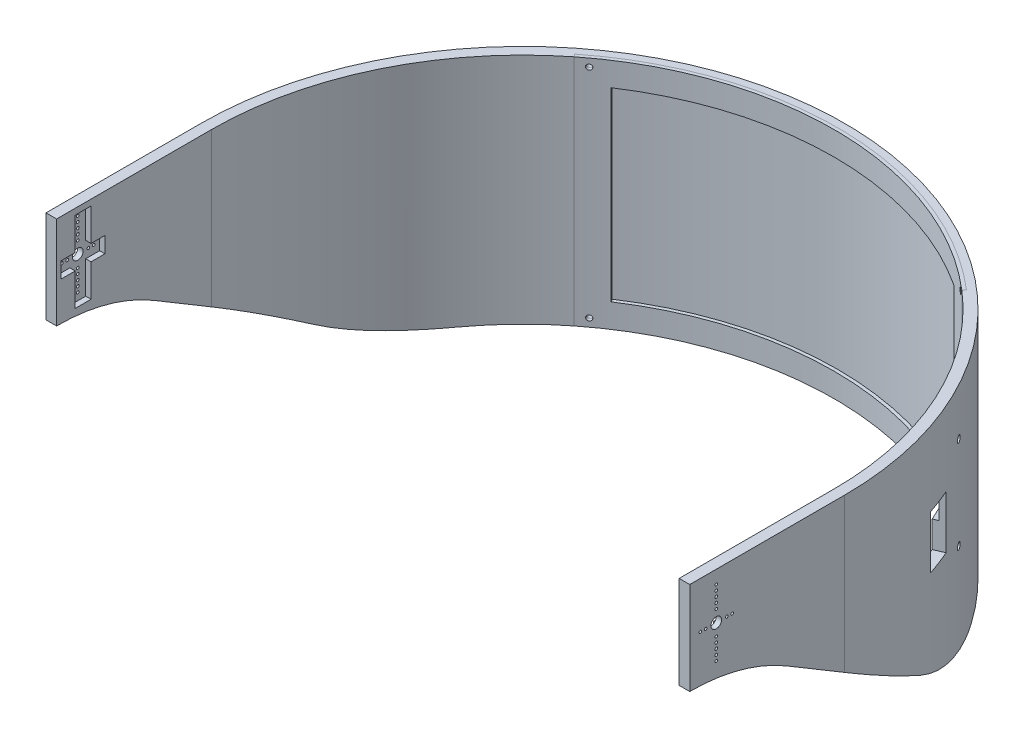
from build123d import *

# Parameters (mm, degrees)
BOSS_EXTRUDE1_DEPTH      = 44
SKETCH2_R                = 2
SKETCH2_R_2              = 0.5
CUT_EXTRUDE1_DEPTH       = 300.808272067
CUT_EXTRUDE2_START       = -2
CUT_EXTRUDE2_DEPTH       = 239
CUT_EXTRUDE3_DEPTH       = 38
CUT_EXTRUDE4_DEPTH       = 28
CUT_EXTRUDE5_DEPTH       = 10
CUT_EXTRUDE6_DEPTH       = 20
CUT_EXTRUDE7_DEPTH       = 214.537467438
CUT_EXTRUDE7_DEPTH_BACK  = 214.537467438
CUT_EXTRUDE8_DEPTH       = 259.793095901
CUT_EXTRUDE8_DEPTH_BACK  = 259.793095901
SKETCH9_R                = 1
CUT_EXTRUDE9_DEPTH       = 260.959679351
CUT_EXTRUDE9_DEPTH_BACK  = 260.959679351
SKETCH10_R               = 1
BOSS_EXTRUDE2_DEPTH      = 44
BOSS_EXTRUDE2_DEPTH_BACK = 44
SKETCH12_R               = 1
CUT_EXTRUDE10_DEPTH      = 259.793096001
SKETCH13_R               = 1
CUT_EXTRUDE12_DEPTH      = 260.959679351
CUT_EXTRUDE13_DEPTH      = 35
CUT_EXTRUDE14_DEPTH      = 264.215137533
CUT_EXTRUDE14_DEPTH_BACK = 264.215137533
SKETCH16_R               = 1.25
BOSS_EXTRUDE3_DEPTH      = 38
BOSS_EXTRUDE3_DEPTH_BACK = 27
SKETCH18_R               = 1.5
CUT_EXTRUDE15_DEPTH      = 251.304617192
CUT_EXTRUDE16_DEPTH      = 300.80827222
CHAMFER2_SIZE            = 50.217391304
CHAMFER2_SIZE_2          = 30
CHAMFER3_SIZE            = 30
CHAMFER3_SIZE_2          = 50.217391304
FILLET1_R                = 71


with BuildPart() as part:
    # Sketch1 → Boss-Extrude1 (new, symmetric)
    with BuildSketch(Plane(origin=(0, 0, 0), x_dir=(1, 0, 0), z_dir=(0, 1, 0))):
        with BuildLine():
            Line((-117.5, -10), (-117.5, 10))
            Line((-117.5, 10), (-117.5, 48.5))
            ThreePointArc((-117.5, 48.5), (0, 166), (117.5, 48.5))
            Line((117.5, 48.5), (117.5, 10))
            Line((117.5, 10), (117.5, -10))
            Line((117.5, -10), (121.5, -10))
            Line((121.5, -10), (121.5, 48.5))
            ThreePointArc((121.5, 48.5), (0, 170), (-121.5, 48.5))
            Line((-121.5, 48.5), (-121.5, -10))
            Line((-121.5, -10), (-117.5, -10))
        make_face()
    extrude(amount=BOSS_EXTRUDE1_DEPTH, both=True)

    # Sketch2 → Cut-Extrude1 (cut, through all)
    with BuildSketch(Plane.ZY.offset(121.5)):
        with Locations((0, 26.5)):
            Circle(SKETCH2_R)
        with Locations((4, 26.5)):
            Circle(SKETCH2_R_2)
        with Locations((6, 26.5)):
            Circle(SKETCH2_R_2)
        with Locations((-6, 26.5)):
            Circle(SKETCH2_R_2)
        with Locations((-4, 26.5)):
            Circle(SKETCH2_R_2)
        with Locations((0, 31)):
            Circle(SKETCH2_R_2)
        with Locations((0, 33)):
            Circle(SKETCH2_R_2)
        with Locations((0, 35)):
            Circle(SKETCH2_R_2)
        with Locations((0, 37)):
            Circle(SKETCH2_R_2)
        with Locations((0, 39)):
            Circle(SKETCH2_R_2)
        with Locations((0, 14)):
            Circle(SKETCH2_R_2)
        with Locations((0, 16)):
            Circle(SKETCH2_R_2)
        with Locations((0, 18)):
            Circle(SKETCH2_R_2)
        with Locations((0, 20)):
            Circle(SKETCH2_R_2)
        with Locations((0, 22)):
            Circle(SKETCH2_R_2)
    extrude(amount=-CUT_EXTRUDE1_DEPTH, mode=Mode.SUBTRACT)

    # Sketch3 → Cut-Extrude2 (cut)
    with BuildSketch(Plane(origin=(-117.5, 0, 0), x_dir=(0, 0, -1), z_dir=(1, 0, 0)).offset(CUT_EXTRUDE2_START)):
        Polygon((-8.25, 29.5), (-8.25, 23.5), (-3, 23.5), (-3, 11.25), (3, 11.25), (3, 23.5), (8.25, 23.5), (8.25, 29.5), (3, 29.5), (3, 41.75), (-3, 41.75), (-3, 29.5), align=None)
    extrude(amount=CUT_EXTRUDE2_DEPTH, mode=Mode.SUBTRACT)

    # Sketch4 → Cut-Extrude3 (cut, symmetric)
    with BuildSketch(Plane(origin=(0, 0, 0), x_dir=(1, 0, 0), z_dir=(0, 1, 0))):
        with BuildLine():
            Line((71.640522456, 144.144579262), (70.441517896, 142.543833166))
            ThreePointArc((70.441517896, 142.543833166), (67.607926189, 144.601083847), (64.714290943, 146.572985821))
            ThreePointArc((64.714290943, 146.572985821), (0, 166), (-64.714290943, 146.572985821))
            ThreePointArc((-64.714290943, 146.572985821), (-65.547021891, 146.01839786), (-66.375000417, 145.456739424))
            Line((-66.375000417, 145.456739424), (-67.504787658, 147.107066903))
            ThreePointArc((-67.504787658, 147.107066903), (-66.662715881, 147.678285483), (-65.815810789, 148.242313239))
            ThreePointArc((-65.815810789, 148.242313239), (0, 168), (65.815810789, 148.242313239))
            ThreePointArc((65.815810789, 148.242313239), (68.7586994, 146.236846976), (71.640522456, 144.144579262))
        make_face()
    extrude(amount=CUT_EXTRUDE3_DEPTH, both=True, mode=Mode.SUBTRACT)

    # Sketch5 → Cut-Extrude4 (cut, symmetric)
    with BuildSketch(Plane(origin=(0, 0, 0), x_dir=(1, 0, 0), z_dir=(0, 1, 0))):
        with BuildLine():
            Line((70.441517896, 142.543833166), (71.640522456, 144.144579262))
            ThreePointArc((71.640522456, 144.144579262), (84.328204672, 133.169970455), (95.354040219, 120.526779838))
            Line((95.354040219, 120.526779838), (93.758156701, 119.321310719))
            ThreePointArc((93.758156701, 119.321310719), (82.916853966, 131.752899819), (70.441517896, 142.543833166))
        make_face()
    extrude(amount=CUT_EXTRUDE4_DEPTH, both=True, mode=Mode.SUBTRACT)

    # Sketch6 → Cut-Extrude5 (cut)
    with BuildSketch(Plane(origin=(0, 16, 0), x_dir=(-1, 0, 0), z_dir=(0, -1, 0))):
        with BuildLine():
            Line((-93.758156701, 119.321310719), (-95.354040219, 120.526779838))
            ThreePointArc((-95.354040219, 120.526779838), (-103.243255193, 108.675412396), (-109.667029947, 95.969911971))
            Line((-109.667029947, 95.969911971), (-107.831598484, 95.175436457))
            ThreePointArc((-107.831598484, 95.175436457), (-101.515334604, 107.668292524), (-93.758156701, 119.321310719))
        make_face()
    extrude(amount=CUT_EXTRUDE5_DEPTH, mode=Mode.SUBTRACT)

    # Sketch7 → Cut-Extrude6 (cut)
    with BuildSketch(Plane(origin=(0, 16, 0), x_dir=(-1, 0, 0), z_dir=(0, -1, 0))):
        with BuildLine():
            Line((-107.831598484, 95.175436457), (-111.502461411, 96.764387486))
            ThreePointArc((-111.502461411, 96.764387486), (-113.455646079, 91.974893591), (-115.203210804, 87.106608508))
            Line((-115.203210804, 87.106608508), (-111.410512506, 85.835609051))
            ThreePointArc((-111.410512506, 85.835609051), (-109.720480776, 90.543621374), (-107.831598484, 95.175436457))
        make_face()
    extrude(amount=CUT_EXTRUDE6_DEPTH, mode=Mode.SUBTRACT)

    # Sketch8 → Cut-Extrude7 (cut, two sides: drawn at the far end of the back side and taken through both)
    with BuildSketch(Plane(origin=(0, 0, 0), x_dir=(1, 0, 0), z_dir=(0, 1, 0)).offset(-CUT_EXTRUDE7_DEPTH_BACK)):
        with BuildLine():
            Line((-72.820611953, 140.71392777), (-73.595299314, 141.694927002))
            ThreePointArc((-73.595299314, 141.694927002), (2.527686356, 167.223095064), (77.495164046, 138.478119838))
            Line((77.495164046, 138.478119838), (76.679425477, 137.530981734))
            ThreePointArc((76.679425477, 137.530981734), (2.501079131, 165.973378274), (-72.820611953, 140.71392777))
        make_face()
    extrude(amount=CUT_EXTRUDE7_DEPTH + CUT_EXTRUDE7_DEPTH_BACK, mode=Mode.SUBTRACT)

    # Sketch9 → Cut-Extrude8 (cut, two sides: drawn at the far end of the back side and taken through both)
    with BuildSketch(Plane(origin=(-93.531066858, 0, -127.111293379), x_dir=(0.8054487063461717, 0, -0.5926654886572009), z_dir=(0.5926654886572009, 0, 0.8054487063461717)).offset(-CUT_EXTRUDE8_DEPTH_BACK)):
        with Locations((28.765559472, 41)):
            Circle(SKETCH9_R)
        with Locations((28.778329435, -41)):
            Circle(SKETCH9_R)
    extrude(amount=CUT_EXTRUDE8_DEPTH + CUT_EXTRUDE8_DEPTH_BACK, mode=Mode.SUBTRACT)

    # Sketch10 → Cut-Extrude9 (cut, two sides: drawn at the far end of the back side and taken through both)
    with BuildSketch(Plane(origin=(98.067880737, 0, -122.034012983), x_dir=(0.7794938560659227, 0, 0.6264098724920278), z_dir=(-0.6264098724920278, 0, 0.7794938560659227)).offset(-CUT_EXTRUDE9_DEPTH_BACK)):
        with Locations((-30.380878816, 41)):
            Circle(SKETCH10_R)
        with Locations((-30.380878816, -41)):
            Circle(SKETCH10_R)
    extrude(amount=CUT_EXTRUDE9_DEPTH + CUT_EXTRUDE9_DEPTH_BACK, mode=Mode.SUBTRACT)

    # Sketch16 → Cut-Extrude14 (cut, two sides: drawn at the far end of the back side and taken through both)
    with BuildSketch(Plane(origin=(106.9937578, 16, -106.072439516), x_dir=(-0.4738472388146497, 0, -0.8806070600828343), z_dir=(0.8806070600828343, 0, -0.4738472388146497)).offset(-CUT_EXTRUDE14_DEPTH_BACK)):
        with Locations((0, -24.75)):
            Circle(SKETCH16_R)
        with Locations((0, 10.25)):
            Circle(SKETCH16_R)
    extrude(amount=CUT_EXTRUDE14_DEPTH + CUT_EXTRUDE14_DEPTH_BACK, mode=Mode.SUBTRACT)

    # Sketch17 → Boss-Extrude3 (add, two sides: drawn at the far end of the back side and taken through both)
    with BuildSketch(Plane(origin=(0, 0, 0), x_dir=(1, 0, 0), z_dir=(0, 1, 0)).offset(-BOSS_EXTRUDE3_DEPTH_BACK)):
        with BuildLine():
            Line((-45.124137252, 161.309849912), (-75.299611509, 149.239607437))
            Line((-75.299611509, 149.239607437), (-75.299611509, 143.853125311))
            ThreePointArc((-75.299611509, 143.853125311), (-60.841220606, 153.66936757), (-45.124137252, 161.309849912))
        make_face()
    extrude(amount=BOSS_EXTRUDE3_DEPTH + BOSS_EXTRUDE3_DEPTH_BACK)

    # Sketch18 → Cut-Extrude15 (cut, through all)
    with BuildSketch(Plane(origin=(-61.848328132, 0, -154.620144312), x_dir=(-0.9284761309654559, 0, 0.3713920761505526), z_dir=(-0.3713920761505526, 0, -0.9284761309654559))):
        with Locations((10.987484307, 34.5)):
            Circle(SKETCH18_R)
        with Locations((10.987484307, -23.5)):
            Circle(SKETCH18_R)
    extrude(amount=-CUT_EXTRUDE15_DEPTH, mode=Mode.SUBTRACT)

    # Sketch19 → Cut-Extrude16 (cut, through all)
    with BuildSketch(Plane.ZY.offset(121.5)):
        Polygon((10, 9), (-10, 9), (-48.5, -14), (-48.5, -44), (10, -44), align=None)
    extrude(amount=-CUT_EXTRUDE16_DEPTH, mode=Mode.SUBTRACT)

    # Chamfer2
    # the kernel refuses this chamfer: 50.217391304, 30 mm, written as the material it takes off along each edge
    with BuildSketch(Plane(origin=(-251.380053142, -44, -48.5), x_dir=(0, -0.019829259578794618, -0.9998033809027438), z_dir=(1, 0, 0))) as chamfer2_piece_1:
        Polygon((CHAMFER2_SIZE * 0.99980338091, CHAMFER2_SIZE * 0.0198292595789), (-CHAMFER2_SIZE_2 * 0.0198292595788, CHAMFER2_SIZE_2 * 0.999803380903), (0, 0), align=None)
    extrude(amount=263.760106283, mode=Mode.SUBTRACT)

    # Chamfer3
    # the kernel refuses this chamfer: 50.217391304, 30 mm, written as the material it takes off along each edge
    with BuildSketch(Plane(origin=(-12.380053142, -44, -48.5), x_dir=(0, 0.998459431976932, 0.05548659924974885), z_dir=(1, 0, 0))) as chamfer3_piece_1:
        Polygon((CHAMFER3_SIZE * 0.998459431977, -CHAMFER3_SIZE * 0.0554865992497), (-CHAMFER3_SIZE_2 * 0.0554865992501, -CHAMFER3_SIZE_2 * 0.998459431984), (0, 0), align=None)
    extrude(amount=263.760106283, mode=Mode.SUBTRACT)

    # Fillet1
    # the kernel refuses this fillet: 71 mm, written as the material it adds along each edge
    with BuildSketch(Plane(origin=(117.5, 9, -10), x_dir=(0, -0.5128552521265802, -0.8584750959498954), z_dir=(1, 0, 0))) as fillet1_piece_1:
        with BuildLine():
            CenterArc((FILLET1_R * 0.27595486926, -FILLET1_R), FILLET1_R, 90, 30.854204506)
            Line((-FILLET1_R * 0.236900382866, -FILLET1_R * 0.14152490405), (0, 0))
            Line((0, 0), (FILLET1_R * 0.27595486926, 0))
        make_face()
    extrude(amount=4)
    with BuildSketch(Plane(origin=(-121.5, 9, -10), x_dir=(0, -0.5128552521254461, -0.8584750959505728), z_dir=(1, 0, 0))) as fillet1_piece_2:
        with BuildLine():
            CenterArc((FILLET1_R * 0.27595486926, -FILLET1_R), FILLET1_R, 90, 30.854204506)
            Line((-FILLET1_R * 0.236900382866, -FILLET1_R * 0.141524904049), (0, 0))
            Line((0, 0), (FILLET1_R * 0.275954869261, 0))
        make_face()
    extrude(amount=4)
    # the kernel refuses this fillet: 71 mm, written as the material it takes off along each edge
    with BuildSketch(Plane(origin=(57.246366669, -44, -98.717391304), x_dir=(0, 0.5128552521258057, 0.858475095950358), z_dir=(1, 0, 0))) as fillet1_2_piece_1:
        with BuildLine():
            CenterArc((FILLET1_R * 0.27595486926, -FILLET1_R), FILLET1_R, 90, 30.854204506)
            Line((-FILLET1_R * 0.236900382866, -FILLET1_R * 0.14152490405), (0, 0))
            Line((0, 0), (FILLET1_R * 0.27595486926, 0))
        make_face()
    extrude(amount=102.372251327, mode=Mode.SUBTRACT)
    with BuildSketch(Plane(origin=(-159.618617996, -44, -98.717391304), x_dir=(0, 0, -1), z_dir=(1, 0, 0))) as fillet1_2_piece_2:
        with BuildLine():
            CenterArc((FILLET1_R * 0.27595486926, FILLET1_R), FILLET1_R, 239.145795494, 30.854204506)
            Line((-FILLET1_R * 0.236900382866, FILLET1_R * 0.14152490405), (0, 0))
            Line((0, 0), (FILLET1_R * 0.27595486926, 0))
        make_face()
    extrude(amount=102.372251327, mode=Mode.SUBTRACT)


with BuildPart() as body_2:
    # Sketch11 → Boss-Extrude2 (new, two sides: drawn at the far end of the back side and taken through both)
    with BuildSketch(Plane(origin=(0, 0, 0), x_dir=(1, 0, 0), z_dir=(0, 1, 0)).offset(-BOSS_EXTRUDE2_DEPTH_BACK)):
        with BuildLine():
            Line((-73.595299314, 141.694927002), (-72.820611953, 140.71392777))
            ThreePointArc((-72.820611953, 140.71392777), (2.501079131, 165.973378274), (76.679425477, 137.530981734))
            Line((76.679425477, 137.530981734), (77.495164046, 138.478119838))
            ThreePointArc((77.495164046, 138.478119838), (2.527686356, 167.223095064), (-73.595299314, 141.694927002))
        make_face()
    extrude(amount=BOSS_EXTRUDE2_DEPTH + BOSS_EXTRUDE2_DEPTH_BACK)

    # Sketch12 → Cut-Extrude10 (cut, through all)
    with BuildSketch(Plane(origin=(-93.531066858, 0, -127.111293379), x_dir=(0.8054487063461717, 0, -0.5926654886572009), z_dir=(0.5926654886572009, 0, 0.8054487063461717))):
        with Locations(Location((28.765559472, 41, 0), (0, 0, 180))):
            Circle(SKETCH12_R)
        with Locations(Location((28.778329435, -41, 0), (0, 0, 180))):
            Circle(SKETCH12_R)
    extrude(amount=CUT_EXTRUDE10_DEPTH, mode=Mode.SUBTRACT)

    # Sketch13 → Cut-Extrude12 (cut, through all)
    with BuildSketch(Plane(origin=(98.067880737, 0, -122.034012983), x_dir=(0.7794938560659227, 0, 0.6264098724920278), z_dir=(-0.6264098724920278, 0, 0.7794938560659227))):
        with Locations(Location((-30.380878816, 41, 0), (0, 0, 180))):
            Circle(SKETCH13_R)
        with Locations(Location((-30.380878816, -41, 0), (0, 0, 180))):
            Circle(SKETCH13_R)
    extrude(amount=CUT_EXTRUDE12_DEPTH, mode=Mode.SUBTRACT)

    # Sketch14 → Cut-Extrude13 (cut, symmetric)
    with BuildSketch(Plane(origin=(0, 0, 0), x_dir=(1, 0, 0), z_dir=(0, 1, 0))):
        with BuildLine():
            Line((-65.402740846, 147.616315457), (-64.714290943, 146.572985821))
            ThreePointArc((-64.714290943, 146.572985821), (0, 166), (64.714290943, 146.572985821))
            Line((64.714290943, 146.572985821), (65.402740846, 147.616315457))
            ThreePointArc((65.402740846, 147.616315457), (0, 167.25), (-65.402740846, 147.616315457))
        make_face()
    extrude(amount=CUT_EXTRUDE13_DEPTH, both=True, mode=Mode.SUBTRACT)


solid = Compound([part.part, body_2.part])
